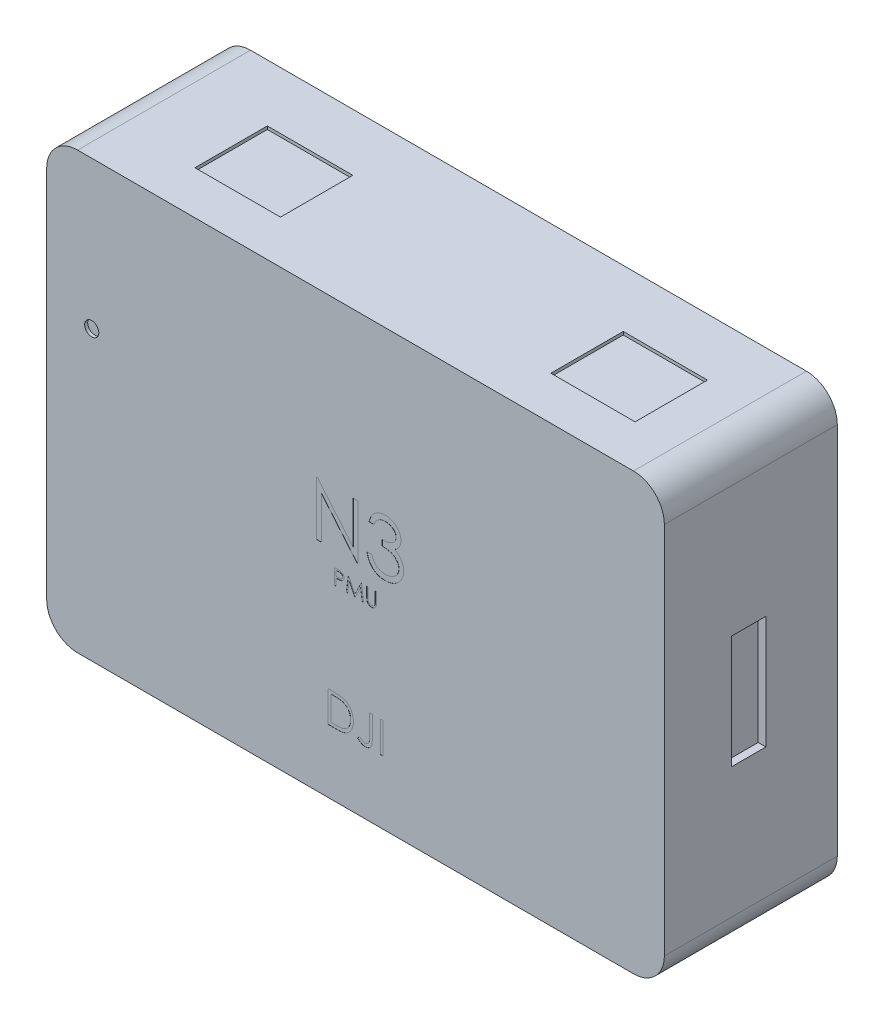
from build123d import *

# Parameters (mm, degrees)
SKETCH_1_W          = 40
SKETCH_1_H          = 28.2
EXTRUDE_1_DEPTH     = 11.2
WRAP_START          = -0.01
WRAP_1_OUTLINE_W    = 0.179487179
WRAP_1_OUTLINE_H    = 2
WRAP_1_DEPTH        = 0.01
FILLET_1_R          = 2
SKETCH_4_W          = 5.453779848
SKETCH_4_H          = 4.686842057
SKETCH_4_W_2        = 5.538995158
CUT_EXTRUDE_1_DEPTH = 0.2
SKETCH_6_W          = 2.403071746
SKETCH_6_H          = 11.775051554
CUT_EXTRUDE_2_DEPTH = 0.5
SKETCH_5_W          = 2.222841365
SKETCH_5_H          = 7.329368824
CUT_EXTRUDE_3_DEPTH = 0.5
SKETCH_7_R          = 0.458898489
CUT_EXTRUDE_4_DEPTH = 0.2


# Read off the part's stored shape, not the designer's step: 包覆1
with BuildPart() as part:
    # 草图1 → 凸台-拉伸1 (new body)
    with BuildSketch(Plane.XY):
        Rectangle(SKETCH_1_W, SKETCH_1_H)
    extrude(amount=EXTRUDE_1_DEPTH)

    # 包覆1 outline → 包覆1 (cut)
    # profile 1 of 8: a face of its own
    with BuildSketch(Plane.XY.offset(11.2).offset(WRAP_START)):
        with BuildLine():
            add(Edge.make_bspline(
                [(0.814102564, -1.599158654), (0.814089209, -1.607638864), (0.814063864, -1.623731524), (0.814233154, -1.646636753), (0.814707259, -1.667000313), (0.815006162, -1.684900698), (0.815671115, -1.700255769), (0.816213414, -1.713148714), (0.816910716, -1.723518487), (0.817748749, -1.72957018), (0.818108974, -1.732171474)],
                knots=[0, 0, 0, 0, 0.191078592, 0.362604556, 0.51609875, 0.650038026, 0.765976721, 0.862374026, 0.940842058, 1, 1, 1, 1], degree=3))
            Line((0.814102564, -1.599158654), (0.814102564, -1))
            Line((0.814102564, -1), (0.724358974, -1))
            Line((0.724358974, -1), (0.724358974, -1.603966346))
            add(Edge.make_bspline(
                [(0.7421875, -1.814703526), (0.740708312, -1.809379933), (0.73749992, -1.797832942), (0.734064121, -1.778722517), (0.731175812, -1.756718254), (0.728459938, -1.731818649), (0.726857379, -1.704004401), (0.725452396, -1.673287568), (0.724349076, -1.639631008), (0.724355583, -1.616186861), (0.724358974, -1.603966346)],
                knots=[0, 0, 0, 0, 0.078129865, 0.169465417, 0.274335291, 0.392110163, 0.52368733, 0.668365421, 0.827131902, 1, 1, 1, 1], degree=3))
            add(Edge.make_bspline(
                [(1.0546875, -2.025641026), (1.045067756, -2.025416807), (1.026193854, -2.024976891), (0.998382977, -2.022456105), (0.971721779, -2.017707992), (0.945928671, -2.011662294), (0.921354815, -2.003324084), (0.897670973, -1.993581762), (0.875282779, -1.981616831), (0.853827028, -1.968304433), (0.833877097, -1.953325965), (0.815563554, -1.937000201), (0.798856162, -1.919588664), (0.784036534, -1.900902845), (0.770859139, -1.881088072), (0.759507649, -1.860088289), (0.749761008, -1.837911627), (0.74473056, -1.822496427), (0.7421875, -1.814703526)],
                knots=[0, 0, 0, 0, 0.071174504, 0.139644122, 0.206317224, 0.27137324, 0.335418084, 0.398076345, 0.460607915, 0.522969511, 0.584715724, 0.64489494, 0.704290561, 0.76299819, 0.821087431, 0.880103891, 0.939388488, 1, 1, 1, 1], degree=3))
            add(Edge.make_bspline(
                [(1.365384615, -1.603966346), (1.36531201, -1.614851597), (1.365170315, -1.636094827), (1.363941579, -1.667223786), (1.361982436, -1.69675321), (1.359214411, -1.724687066), (1.355546696, -1.750925397), (1.351468061, -1.775698188), (1.346273909, -1.798827614), (1.340207223, -1.820494019), (1.333271923, -1.841118452), (1.324288738, -1.860692342), (1.314167452, -1.879810742), (1.302163266, -1.898184487), (1.288674299, -1.915894931), (1.273402391, -1.932834666), (1.25685263, -1.949274394), (1.238749899, -1.964792413), (1.219392606, -1.979023463), (1.198838333, -1.991537112), (1.17724497, -2.002115289), (1.154668648, -2.010822696), (1.131099733, -2.017369724), (1.10653763, -2.02224834), (1.080926432, -2.025020425), (1.063507959, -2.025432405), (1.0546875, -2.025641026)],
                knots=[0, 0, 0, 0, 0.054858035, 0.107058792, 0.156978355, 0.203992277, 0.248491536, 0.290483314, 0.330489004, 0.367885926, 0.403858131, 0.440009343, 0.476295011, 0.512792295, 0.550484825, 0.588381116, 0.627645327, 0.667979464, 0.708432758, 0.748602302, 0.789087777, 0.829461205, 0.870371045, 0.912214227, 0.955546575, 1, 1, 1, 1], degree=3))
            Line((1.365384615, -1.603966346), (1.365384615, -1))
            Line((1.365384615, -1), (1.275641026, -1))
            Line((1.275641026, -1), (1.275641026, -1.599158654))
            add(Edge.make_bspline(
                [(1.265424679, -1.754407051), (1.266281858, -1.750878887), (1.268191998, -1.743016716), (1.269976868, -1.729724918), (1.271835875, -1.714042243), (1.273125752, -1.695856011), (1.274383244, -1.675227161), (1.27513555, -1.652048231), (1.275483274, -1.626403385), (1.275586897, -1.608507053), (1.275641026, -1.599158654)],
                knots=[0, 0, 0, 0, 0.069835104, 0.155620755, 0.257801557, 0.373811234, 0.506402493, 0.655564458, 0.820079282, 1, 1, 1, 1], degree=3))
            add(Edge.make_bspline(
                [(1.049679487, -1.923076923), (1.057837699, -1.922770109), (1.074107002, -1.922158252), (1.098280268, -1.918369272), (1.121823156, -1.911540539), (1.144851922, -1.902729179), (1.166437917, -1.89108701), (1.186593187, -1.877638199), (1.204582882, -1.861863663), (1.220999453, -1.844406422), (1.235295149, -1.824709336), (1.247686904, -1.803201297), (1.257837169, -1.779558626), (1.262849605, -1.762943077), (1.265424679, -1.754407051)],
                knots=[0, 0, 0, 0, 0.082890648, 0.165302541, 0.247761876, 0.331527711, 0.415279813, 0.49636623, 0.577151348, 0.65778254, 0.739321642, 0.823793082, 0.909475953, 1, 1, 1, 1], degree=3))
            add(Edge.make_bspline(
                [(0.818108974, -1.732171474), (0.819588248, -1.741556264), (0.822463444, -1.759797044), (0.829790981, -1.785770838), (0.840024553, -1.809179827), (0.852151136, -1.830754481), (0.868131882, -1.849894298), (0.88727575, -1.867526199), (0.910469398, -1.882946715), (0.936258142, -1.897046947), (0.964053924, -1.908379827), (0.992457143, -1.91694936), (1.021040852, -1.922171903), (1.040176899, -1.922776628), (1.049679487, -1.923076923)],
                knots=[0, 0, 0, 0, 0.086315004, 0.167766466, 0.244432684, 0.318134662, 0.391884107, 0.47006805, 0.553904179, 0.644339498, 0.736874663, 0.826168364, 0.913678595, 1, 1, 1, 1], degree=3))
        make_face()
    # profile 2 of 8: a face of its own
    with BuildSketch(Plane.XY.offset(11.2).offset(WRAP_START)):
        with BuildLine():
            add(Edge.make_bspline(
                [(-1.169270833, -1), (-1.155782003, -1.000014827), (-1.129936805, -1.000043238), (-1.092875361, -1.000904594), (-1.059215437, -1.002055077), (-1.029029614, -1.003649904), (-1.002225015, -1.005534644), (-0.978922929, -1.008178084), (-0.958940199, -1.010938168), (-0.946966927, -1.013744284), (-0.94150641, -1.015024038)],
                knots=[0, 0, 0, 0, 0.176955752, 0.33905508, 0.486318225, 0.618780923, 0.735618828, 0.838742477, 0.926457068, 1, 1, 1, 1], degree=3))
            Line((-1.169270833, -1), (-1.365384615, -1))
            Line((-1.365384615, -1), (-1.365384615, -2))
            Line((-1.365384615, -2), (-1.275641026, -2))
            Line((-1.275641026, -2), (-1.275641026, -1.538461538))
            Line((-1.275641026, -1.538461538), (-1.204126603, -1.538461538))
            add(Edge.make_bspline(
                [(-0.949519231, -1.522035256), (-0.955784183, -1.523367537), (-0.969514191, -1.526287306), (-0.992126397, -1.529546866), (-1.018453651, -1.532329037), (-1.048460016, -1.534415077), (-1.082118561, -1.536200896), (-1.119447491, -1.537620351), (-1.160520085, -1.53840031), (-1.189169012, -1.538440536), (-1.204126603, -1.538461538)],
                knots=[0, 0, 0, 0, 0.075173117, 0.164746258, 0.268016881, 0.385911876, 0.517789479, 0.663690977, 0.824413221, 1, 1, 1, 1], degree=3))
            add(Edge.make_bspline(
                [(-0.75, -1.268229167), (-0.750120407, -1.276451389), (-0.750355992, -1.292538721), (-0.753183502, -1.316073804), (-0.756992128, -1.338564772), (-0.762848429, -1.359961758), (-0.770518621, -1.380137692), (-0.77951635, -1.399400902), (-0.790368788, -1.417423665), (-0.802838739, -1.434271413), (-0.816710623, -1.449959959), (-0.831925748, -1.464375615), (-0.848422689, -1.477433997), (-0.866149017, -1.489164381), (-0.885277545, -1.499294747), (-0.90551816, -1.508368262), (-0.927046794, -1.515988565), (-0.941944655, -1.519997154), (-0.949519231, -1.522035256)],
                knots=[0, 0, 0, 0, 0.070118894, 0.137192353, 0.202016181, 0.264631407, 0.326116547, 0.386010305, 0.445811847, 0.505297697, 0.564633278, 0.624282625, 0.683902032, 0.743952771, 0.805387731, 0.868388031, 0.933084028, 1, 1, 1, 1], degree=3))
            add(Edge.make_bspline(
                [(-0.94150641, -1.015024038), (-0.934593972, -1.016916024), (-0.920931979, -1.020655413), (-0.901245966, -1.028145048), (-0.882516296, -1.037025667), (-0.864678708, -1.047146793), (-0.847952399, -1.058942668), (-0.832087815, -1.07193513), (-0.817224964, -1.08642415), (-0.803447423, -1.102247219), (-0.790794624, -1.119138707), (-0.779900429, -1.137350773), (-0.770778364, -1.156576859), (-0.762954572, -1.176803594), (-0.757323585, -1.198200829), (-0.753081614, -1.22061989), (-0.750389149, -1.244058373), (-0.750131274, -1.260075478), (-0.75, -1.268229167)],
                knots=[0, 0, 0, 0, 0.062481339, 0.123490383, 0.183411094, 0.243153221, 0.302126735, 0.361709671, 0.421842292, 0.482931901, 0.544552254, 0.60568072, 0.667679738, 0.729984388, 0.794550921, 0.86034562, 0.928907356, 1, 1, 1, 1], degree=3))
        make_face()
        with BuildLine():
            add(Edge.make_bspline(
                [(-1.100560897, -1.438100962), (-1.092012347, -1.43810538), (-1.075509547, -1.438113909), (-1.051670626, -1.436975274), (-1.029553687, -1.435660836), (-1.009226666, -1.433736286), (-0.990680399, -1.431015927), (-0.973883962, -1.428269716), (-0.958967595, -1.424296755), (-0.94151068, -1.418947307), (-0.922058295, -1.409823702), (-0.900896139, -1.396580877), (-0.882961685, -1.379700674), (-0.867442172, -1.360721294), (-0.855126207, -1.339607257), (-0.846110209, -1.317016132), (-0.840812736, -1.293179604), (-0.840102395, -1.276868707), (-0.83974359, -1.268629808)],
                knots=[0, 0, 0, 0, 0.072538371, 0.140033831, 0.202495681, 0.260575056, 0.313228338, 0.361583194, 0.404878361, 0.444127437, 0.516399693, 0.586506671, 0.655085374, 0.724383783, 0.793973529, 0.861637682, 0.930110942, 1, 1, 1, 1], degree=3))
            Line((-1.100560897, -1.438100962), (-1.275641026, -1.435897436))
            Line((-1.275641026, -1.435897436), (-1.275641026, -1.102564103))
            Line((-1.275641026, -1.102564103), (-1.092748397, -1.102564103))
            add(Edge.make_bspline(
                [(-0.83974359, -1.268629808), (-0.840104346, -1.260590232), (-0.840821484, -1.244608552), (-0.846151731, -1.221186049), (-0.855108678, -1.19883299), (-0.867524848, -1.177983537), (-0.882593742, -1.159072451), (-0.90010784, -1.1426447), (-0.920025915, -1.129438499), (-0.938553981, -1.120914704), (-0.955011462, -1.11571034), (-0.969306308, -1.112068957), (-0.985446501, -1.109161641), (-1.003437295, -1.106807497), (-1.023139248, -1.104792223), (-1.044721623, -1.103424801), (-1.068102664, -1.102624385), (-1.084334256, -1.102584683), (-1.092748397, -1.102564103)],
                knots=[0, 0, 0, 0, 0.070043755, 0.139238317, 0.208197455, 0.279173374, 0.349986812, 0.418353846, 0.487609584, 0.557411073, 0.595330157, 0.637964052, 0.685912778, 0.738185165, 0.796102647, 0.858516544, 0.926657726, 1, 1, 1, 1], degree=3))
        make_face(mode=Mode.SUBTRACT)
    # profile 3 of 8: a face of its own
    with BuildSketch(Plane.XY.offset(11.2).offset(WRAP_START)):
        with BuildLine():
            add(Edge.make_bspline(
                [(0.876438504, 2.692307692), (0.884948055, 2.727540176), (0.901583531, 2.796416801), (0.936281104, 2.894824062), (0.974080359, 2.987947583), (1.019469464, 3.074043657), (1.068978218, 3.154842559), (1.12570094, 3.228511684), (1.187020662, 3.296924649), (1.254845612, 3.357637887), (1.325974273, 3.412615616), (1.401408893, 3.459490673), (1.479631787, 3.499814826), (1.56118492, 3.533035058), (1.646311091, 3.558060582), (1.734240715, 3.576217387), (1.825204215, 3.588008502), (1.886951805, 3.589159265), (1.918305492, 3.58974359)],
                knots=[0, 0, 0, 0, 0.072625346, 0.141976611, 0.208984928, 0.27395687, 0.336889347, 0.398744953, 0.460115885, 0.520824923, 0.580994459, 0.640151928, 0.698622451, 0.757271081, 0.816426694, 0.876254048, 0.937165293, 1, 1, 1, 1], degree=3))
            Line((0.876438504, 2.692307692), (1.190541069, 2.692307692))
            add(Edge.make_bspline(
                [(1.922512222, 3.230769231), (1.882660554, 3.229377869), (1.804820978, 3.226660215), (1.692606061, 3.202857202), (1.588286727, 3.164879118), (1.508548061, 3.119546099), (1.449665486, 3.074795665), (1.407588548, 3.035713279), (1.366268038, 2.992280455), (1.328422361, 2.94182208), (1.290148384, 2.887755289), (1.255303823, 2.827331608), (1.22144413, 2.762127214), (1.201041581, 2.716031579), (1.190541069, 2.692307692)],
                knots=[0, 0, 0, 0, 0.122711942, 0.239684964, 0.351815855, 0.463766133, 0.520817793, 0.579448291, 0.640604145, 0.705297512, 0.773633881, 0.844669382, 0.920056508, 1, 1, 1, 1], degree=3))
            add(Edge.make_bspline(
                [(2.626438504, 2.681790865), (2.626024094, 2.700068611), (2.625199643, 2.736431318), (2.614802365, 2.789556386), (2.599178324, 2.841057332), (2.577698594, 2.890715142), (2.548948396, 2.938185416), (2.514542409, 2.983872865), (2.473574309, 3.027516644), (2.426628862, 3.068196964), (2.376217057, 3.106966201), (2.320967282, 3.139879838), (2.262545407, 3.1680249), (2.200886752, 3.191234402), (2.135791222, 3.20869369), (2.067564664, 3.221229532), (1.996076981, 3.229067187), (1.947305249, 3.230195602), (1.922512222, 3.230769231)],
                knots=[0, 0, 0, 0, 0.055274549, 0.109966094, 0.163247443, 0.218076185, 0.273300874, 0.3309093, 0.390994523, 0.454175953, 0.518861541, 0.583310532, 0.648516682, 0.715030887, 0.782502073, 0.852322685, 0.92492849, 1, 1, 1, 1], degree=3))
            add(Edge.make_bspline(
                [(1.729002607, 2.108974359), (1.772303773, 2.109709163), (1.857120119, 2.111148463), (1.981014424, 2.128556473), (2.099487736, 2.152637101), (2.209914478, 2.189522293), (2.310563192, 2.23236259), (2.397882794, 2.2822148), (2.470649941, 2.337629549), (2.528511012, 2.399462158), (2.572040241, 2.465777206), (2.603867038, 2.534893864), (2.622667365, 2.607417924), (2.625177032, 2.656912592), (2.626438504, 2.681790865)],
                knots=[0, 0, 0, 0, 0.110165553, 0.215787256, 0.318027435, 0.417573954, 0.511650488, 0.596162097, 0.672934533, 0.743669557, 0.810677001, 0.874058962, 0.936696302, 1, 1, 1, 1], degree=3))
            Line((1.729002607, 2.108974359), (1.729002607, 1.75))
            add(Edge.make_bspline(
                [(2.805925684, 1.009615385), (2.804395382, 1.042226723), (2.801342394, 1.107287132), (2.778033815, 1.203004706), (2.73969495, 1.295228118), (2.686022439, 1.382383909), (2.62068671, 1.46315981), (2.544321803, 1.535231293), (2.456293575, 1.594701384), (2.375273706, 1.63579004), (2.30350855, 1.663827115), (2.242093165, 1.68250208), (2.173336562, 1.698315735), (2.098070213, 1.713028007), (2.015726996, 1.725549355), (1.926396558, 1.735991171), (1.830060797, 1.744346212), (1.763369631, 1.748077307), (1.729002607, 1.75)],
                knots=[0, 0, 0, 0, 0.066909186, 0.13348544, 0.201035117, 0.27123434, 0.342879984, 0.41383613, 0.485976622, 0.560229557, 0.599884181, 0.64405484, 0.691891932, 0.744687524, 0.801491775, 0.862857698, 0.929328379, 1, 1, 1, 1], degree=3))
            add(Edge.make_bspline(
                [(1.914799883, 0.269230769), (1.947553385, 0.269846674), (2.011600032, 0.271051024), (2.105054892, 0.282126731), (2.193962339, 0.298257144), (2.277335265, 0.323170127), (2.356265772, 0.353950979), (2.429647422, 0.392599384), (2.498443528, 0.437944106), (2.561772933, 0.489483264), (2.618718441, 0.545904759), (2.668857954, 0.60491783), (2.711482616, 0.66627366), (2.745866194, 0.730311781), (2.773016744, 0.79676701), (2.791499945, 0.865825839), (2.80435146, 0.936923105), (2.805398072, 0.985252074), (2.805925684, 1.009615385)],
                knots=[0, 0, 0, 0, 0.076071737, 0.148751715, 0.218402794, 0.285759581, 0.350598024, 0.414964045, 0.478069339, 0.541760676, 0.604349859, 0.664075021, 0.721463623, 0.777587128, 0.832644447, 0.887843511, 0.943460343, 1, 1, 1, 1], degree=3))
            add(Edge.make_bspline(
                [(1.330064306, 0.458533654), (1.349660882, 0.44342532), (1.388793545, 0.413255288), (1.452561776, 0.37475366), (1.519626662, 0.341392634), (1.591441337, 0.315908939), (1.666456107, 0.294331278), (1.745883472, 0.280210759), (1.829022689, 0.270522587), (1.885790453, 0.269667656), (1.914799883, 0.269230769)],
                knots=[0, 0, 0, 0, 0.118271305, 0.236177533, 0.355662933, 0.475904165, 0.600127342, 0.728608116, 0.861313476, 1, 1, 1, 1], degree=3))
            add(Edge.make_bspline(
                [(1.055925684, 0.942307692), (1.064108975, 0.915358679), (1.080026188, 0.862940507), (1.107120486, 0.787500202), (1.137988758, 0.718342149), (1.171103317, 0.654959027), (1.205881763, 0.596726624), (1.244796688, 0.545184755), (1.284965833, 0.498069553), (1.315245186, 0.471524941), (1.330064306, 0.458533654)],
                knots=[0, 0, 0, 0, 0.149770386, 0.29131641, 0.425966373, 0.552159574, 0.671527414, 0.786121629, 0.895325073, 1, 1, 1, 1], degree=3))
            Line((1.055925684, 0.942307692), (0.74182312, 0.942307692))
            add(Edge.make_bspline(
                [(1.909190908, -0.08974359), (1.871771608, -0.088875376), (1.798142903, -0.087167022), (1.689899405, -0.075488421), (1.586577705, -0.054158416), (1.488038107, -0.025455111), (1.394193071, 0.010936632), (1.305328966, 0.05625533), (1.220899072, 0.109566832), (1.141700121, 0.171500419), (1.067741553, 0.240781759), (1.000988829, 0.318640769), (0.940329036, 0.403638173), (0.887386398, 0.496761229), (0.839749445, 0.596806487), (0.800568488, 0.705054985), (0.76608292, 0.820539007), (0.750049455, 0.901016747), (0.74182312, 0.942307692)],
                knots=[0, 0, 0, 0, 0.06554117, 0.128963168, 0.190377136, 0.250092362, 0.308548432, 0.366397963, 0.424542189, 0.483169996, 0.5422434, 0.601739352, 0.662506002, 0.724855513, 0.789127829, 0.8563464, 0.926295235, 1, 1, 1, 1], degree=3))
            add(Edge.make_bspline(
                [(3.120028248, 1.039763622), (3.118233735, 0.990753901), (3.114653153, 0.892965099), (3.082649078, 0.748490377), (3.033035838, 0.607264875), (2.962578902, 0.472190036), (2.876711393, 0.345809655), (2.774554069, 0.232733346), (2.65726766, 0.135534741), (2.526462011, 0.054324513), (2.384744883, -0.010593409), (2.233169291, -0.055650852), (2.073919237, -0.084996852), (1.964711939, -0.08814372), (1.909190908, -0.08974359)],
                knots=[0, 0, 0, 0, 0.079648251, 0.158921676, 0.239619495, 0.32260943, 0.406034637, 0.487602095, 0.569684627, 0.653036145, 0.737435718, 0.822477816, 0.909747655, 1, 1, 1, 1], degree=3))
            add(Edge.make_bspline(
                [(2.911093953, 1.661658654), (2.927935296, 1.638600902), (2.961342192, 1.592862986), (3.002577725, 1.51932656), (3.03998684, 1.444975071), (3.069137059, 1.367815664), (3.091710926, 1.288742651), (3.107846958, 1.207620255), (3.117871099, 1.124382232), (3.119306651, 1.068069752), (3.120028248, 1.039763622)],
                knots=[0, 0, 0, 0, 0.12813551, 0.254172712, 0.378111645, 0.501712263, 0.623986309, 0.747095614, 0.872874637, 1, 1, 1, 1], degree=3))
            add(Edge.make_bspline(
                [(2.531787062, 1.960336538), (2.569018817, 1.942358367), (2.642785691, 1.906738409), (2.743336221, 1.836882652), (2.834614096, 1.756226304), (2.885517815, 1.693283652), (2.911093953, 1.661658654)],
                knots=[0, 0, 0, 0, 0.2538796, 0.503008917, 0.750291081, 1, 1, 1, 1], degree=3))
            add(Edge.make_bspline(
                [(2.940541069, 2.680388622), (2.939377478, 2.643381827), (2.93710051, 2.570965273), (2.917766805, 2.465243775), (2.885230542, 2.365602175), (2.840160779, 2.271621013), (2.781819229, 2.183896173), (2.711146532, 2.102230282), (2.62764387, 2.026261124), (2.564364932, 1.982741651), (2.531787062, 1.960336538)],
                knots=[0, 0, 0, 0, 0.128067549, 0.250608319, 0.370630166, 0.490072247, 0.610374764, 0.73431307, 0.863216504, 1, 1, 1, 1], degree=3))
            add(Edge.make_bspline(
                [(1.918305492, 3.58974359), (1.963988234, 3.588364359), (2.054357245, 3.585635984), (2.187120292, 3.560721548), (2.315147111, 3.521296415), (2.437036359, 3.466822688), (2.550254791, 3.399635375), (2.650990978, 3.319670638), (2.737879489, 3.228471337), (2.810773866, 3.127738772), (2.867848865, 3.020083263), (2.909935239, 2.909283106), (2.93555692, 2.795601134), (2.938877477, 2.718843855), (2.940541069, 2.680388622)],
                knots=[0, 0, 0, 0, 0.090254249, 0.178539792, 0.266093034, 0.354630978, 0.441886153, 0.525746915, 0.608113634, 0.690197273, 0.770821484, 0.848326181, 0.92401174, 1, 1, 1, 1], degree=3))
        make_face()
    # profile 4 of 8: a face of its own
    with BuildSketch(Plane.XY.offset(11.2).offset(WRAP_START)):
        with BuildLine():
            add(Edge.make_bspline(
                [(-1.378205128, -8), (-1.343079992, -8.000252897), (-1.275218412, -8.000741493), (-1.177154156, -8.003839431), (-1.086420578, -8.009319697), (-1.003316087, -8.017302283), (-0.927612537, -8.027104017), (-0.859521904, -8.039389962), (-0.798692108, -8.053897488), (-0.761280999, -8.066266317), (-0.743589744, -8.072115385)],
                knots=[0, 0, 0, 0, 0.164289216, 0.317405911, 0.458843612, 0.589366542, 0.707831319, 0.815770031, 0.912879903, 1, 1, 1, 1], degree=3))
            Line((-1.378205128, -8), (-1.782051282, -8))
            Line((-1.782051282, -8), (-1.782051282, -10))
            Line((-1.782051282, -10), (-1.162259615, -10))
            add(Edge.make_bspline(
                [(-0.141025641, -9.025240385), (-0.141385051, -9.049961092), (-0.142093306, -9.098675829), (-0.148452915, -9.170470626), (-0.157696526, -9.240135524), (-0.172007497, -9.307338781), (-0.189380361, -9.372669192), (-0.211645591, -9.435430474), (-0.237151589, -9.496198365), (-0.266894376, -9.554151209), (-0.299546596, -9.609055993), (-0.334587592, -9.660813437), (-0.37197999, -9.708684993), (-0.412080351, -9.752815628), (-0.454370475, -9.793138816), (-0.499127236, -9.829991396), (-0.546466122, -9.862652284), (-0.596175106, -9.892404918), (-0.649704323, -9.918359407), (-0.708067675, -9.940319412), (-0.771514062, -9.958517478), (-0.839887752, -9.973700847), (-0.913306882, -9.98574502), (-0.991843434, -9.993817244), (-1.075376742, -9.999276063), (-1.132736323, -9.999754002), (-1.162259615, -10)],
                knots=[0, 0, 0, 0, 0.046080683, 0.0908068, 0.134295271, 0.177024386, 0.218822734, 0.260244116, 0.301079867, 0.341613894, 0.381583419, 0.420119591, 0.458074619, 0.494738488, 0.531194623, 0.566933698, 0.602712651, 0.638326606, 0.674853249, 0.713467371, 0.754441804, 0.797815361, 0.843989456, 0.89307157, 0.944963346, 1, 1, 1, 1], degree=3))
            add(Edge.make_bspline(
                [(-0.743589744, -8.072115385), (-0.720449893, -8.080932931), (-0.674694926, -8.09836807), (-0.609547998, -8.131257385), (-0.54821922, -8.168522015), (-0.490379708, -8.210211079), (-0.437350665, -8.257504993), (-0.387060438, -8.308394756), (-0.34156631, -8.36473095), (-0.299904426, -8.425345229), (-0.262341192, -8.489523545), (-0.229690245, -8.557143607), (-0.202573678, -8.627862011), (-0.180063262, -8.701482096), (-0.162322429, -8.77816574), (-0.150218468, -8.858002235), (-0.142235046, -8.940676058), (-0.141432731, -8.996775751), (-0.141025641, -9.025240385)],
                knots=[0, 0, 0, 0, 0.061544966, 0.121694296, 0.181154855, 0.239875389, 0.298701942, 0.357647424, 0.417604843, 0.478494041, 0.540407051, 0.602344994, 0.665004328, 0.728559309, 0.793650542, 0.860534268, 0.929235961, 1, 1, 1, 1], degree=3))
        make_face()
        with BuildLine():
            add(Edge.make_bspline(
                [(-1.372996795, -9.794871795), (-1.340009154, -9.794730026), (-1.276561841, -9.794457351), (-1.1853287, -9.792064664), (-1.101969045, -9.788154985), (-1.026471039, -9.782683512), (-0.958877311, -9.775444303), (-0.899046597, -9.76737293), (-0.847175021, -9.757317244), (-0.815786771, -9.74820241), (-0.801282051, -9.743990385)],
                knots=[0, 0, 0, 0, 0.171900665, 0.330627932, 0.475548836, 0.60674619, 0.725023803, 0.829742387, 0.92132282, 1, 1, 1, 1], degree=3))
            Line((-1.372996795, -9.794871795), (-1.602564103, -9.794871795))
            Line((-1.602564103, -9.794871795), (-1.602564103, -8.205128205))
            Line((-1.602564103, -8.205128205), (-1.461939103, -8.205128205))
            add(Edge.make_bspline(
                [(-0.847355769, -8.261217949), (-0.864127853, -8.25657999), (-0.899789904, -8.246718417), (-0.957983884, -8.235961061), (-1.023478255, -8.226472776), (-1.096563799, -8.218439611), (-1.177157204, -8.212675427), (-1.265320454, -8.208348962), (-1.361091657, -8.205430886), (-1.427481676, -8.205231625), (-1.461939103, -8.205128205)],
                knots=[0, 0, 0, 0, 0.084318617, 0.179284514, 0.286582528, 0.405111483, 0.535592873, 0.67819021, 0.83297584, 1, 1, 1, 1], degree=3))
            add(Edge.make_bspline(
                [(-0.320512821, -9.024839744), (-0.320806128, -9.001449183), (-0.321382332, -8.955498221), (-0.328624795, -8.888074966), (-0.339208541, -8.82322888), (-0.354513504, -8.760955626), (-0.374016864, -8.70113371), (-0.398356659, -8.64409399), (-0.426166156, -8.589234065), (-0.459253777, -8.537820142), (-0.495491259, -8.489195508), (-0.53570719, -8.444649842), (-0.57926264, -8.404081671), (-0.625682554, -8.366859206), (-0.676275183, -8.334479963), (-0.72984872, -8.305516145), (-0.787189104, -8.280935636), (-0.827082073, -8.267862), (-0.847355769, -8.261217949)],
                knots=[0, 0, 0, 0, 0.070151176, 0.137812606, 0.203226247, 0.267174055, 0.330024003, 0.391794272, 0.453084399, 0.514333908, 0.574999993, 0.634865483, 0.694116315, 0.753441622, 0.8131258, 0.874079686, 0.936007013, 1, 1, 1, 1], degree=3))
            add(Edge.make_bspline(
                [(-0.801282051, -9.743990385), (-0.783025844, -9.737560923), (-0.74694948, -9.724855567), (-0.695017431, -9.70167976), (-0.646584857, -9.674227149), (-0.6008077, -9.643711564), (-0.558335325, -9.609056706), (-0.518664401, -9.57101614), (-0.481874801, -9.529396269), (-0.448346625, -9.484248748), (-0.41834188, -9.435854579), (-0.39235832, -9.384689531), (-0.369586016, -9.331314211), (-0.351712535, -9.274908978), (-0.337703629, -9.215978087), (-0.327780951, -9.154517394), (-0.321601108, -9.090538376), (-0.320880281, -9.047022876), (-0.320512821, -9.024839744)],
                knots=[0, 0, 0, 0, 0.0624145, 0.123338231, 0.183124538, 0.241782995, 0.300578883, 0.359680075, 0.418881641, 0.479530664, 0.540850536, 0.602303396, 0.664463212, 0.727805723, 0.792894815, 0.859672328, 0.928464401, 1, 1, 1, 1], degree=3))
        make_face(mode=Mode.SUBTRACT)
    # profile 5 of 8: a face of its own
    with BuildSketch(Plane.XY.offset(11.2).offset(WRAP_START)):
        with BuildLine():
            add(Edge.make_bspline(
                [(1.08974359, -9.350560897), (1.089564208, -9.375535281), (1.089219772, -9.423489144), (1.087325823, -9.492559942), (1.083820979, -9.555628906), (1.078715257, -9.612839447), (1.071903696, -9.664012335), (1.064108823, -9.709542974), (1.054672938, -9.749051364), (1.040463528, -9.793414424), (1.017164129, -9.842068027), (0.98209725, -9.894613828), (0.938535652, -9.940575776), (0.888077919, -9.980491619), (0.830283048, -10.012295751), (0.766341208, -10.035127282), (0.696646016, -10.049053486), (0.648303609, -10.050524289), (0.623397436, -10.051282051)],
                knots=[0, 0, 0, 0, 0.077360684, 0.148541953, 0.214007737, 0.272994503, 0.326409196, 0.373880401, 0.416019938, 0.45212552, 0.518001711, 0.58236693, 0.647043782, 0.713330421, 0.78091197, 0.850394959, 0.922922974, 1, 1, 1, 1], degree=3))
            Line((1.08974359, -9.350560897), (1.08974359, -8))
            Line((1.08974359, -8), (0.91025641, -8))
            Line((0.91025641, -8), (0.91025641, -9.330528846))
            add(Edge.make_bspline(
                [(0.633413462, -9.846153846), (0.647232198, -9.845569426), (0.674546744, -9.844414243), (0.714240455, -9.834214658), (0.752216473, -9.818646427), (0.78711342, -9.795851402), (0.819276499, -9.768747733), (0.845815256, -9.735972871), (0.867939396, -9.699649452), (0.881253506, -9.665265764), (0.889736233, -9.633907689), (0.89512002, -9.605088755), (0.899827826, -9.571396481), (0.90393157, -9.532790652), (0.906334124, -9.489193977), (0.909029709, -9.440734467), (0.910004144, -9.387289945), (0.910169755, -9.350026544), (0.91025641, -9.330528846)],
                knots=[0, 0, 0, 0, 0.062326366, 0.123196245, 0.18403622, 0.246964085, 0.310699396, 0.373267637, 0.43658758, 0.502124791, 0.539004722, 0.583255376, 0.634446515, 0.692676046, 0.758570486, 0.831658675, 0.911917102, 1, 1, 1, 1], degree=3))
            add(Edge.make_bspline(
                [(0.502403846, -9.817307692), (0.513423453, -9.821627382), (0.535035355, -9.830099256), (0.568078258, -9.839554055), (0.600932565, -9.844721146), (0.622714104, -9.845681908), (0.633413462, -9.846153846)],
                knots=[0, 0, 0, 0, 0.262951626, 0.515706692, 0.762109227, 1, 1, 1, 1], degree=3))
            add(Edge.make_bspline(
                [(0.246794872, -9.666666667), (0.271196403, -9.68349375), (0.317269675, -9.715265478), (0.384986498, -9.756137821), (0.444984871, -9.791180773), (0.48423227, -9.809039218), (0.502403846, -9.817307692)],
                knots=[0, 0, 0, 0, 0.299184288, 0.564898946, 0.798547869, 1, 1, 1, 1], degree=3))
            Line((0.246794872, -9.666666667), (0.141025641, -9.820512821))
            add(Edge.make_bspline(
                [(0.623397436, -10.051282051), (0.60399266, -10.05066456), (0.564948965, -10.049422128), (0.506839988, -10.039295435), (0.448896002, -10.023686267), (0.39080946, -10.000827641), (0.331432751, -9.969738728), (0.269961695, -9.929061689), (0.205605586, -9.878872246), (0.163215137, -9.840564963), (0.141025641, -9.820512821)],
                knots=[0, 0, 0, 0, 0.106070902, 0.21342168, 0.321685488, 0.433857939, 0.554081283, 0.687587044, 0.83646585, 1, 1, 1, 1], degree=3))
        make_face()
    # profile 6 of 8: a face of its own
    with BuildSketch(Plane.XY.offset(11.2).offset(WRAP_START)):
        Polygon((-2.467912457, 3.5), (-2.533817906, 3.5), (-2.533817906, 0), (-2.219715342, 0), (-2.219715342, 2.748397436), (0.086975363, 0), (0.158489787, 0), (0.158489787, 3.5), (-0.155612778, 3.5), (-0.155612778, 0.745292468), align=None)
    # profile 7 of 8: a face of its own
    with BuildSketch(Plane.XY.offset(11.2).offset(WRAP_START)):
        Polygon((-0.451322115, -1), (-0.464142628, -1), (-0.596153846, -2), (-0.505809295, -2), (-0.41025641, -1.278846154), (-0.047876603, -2), (-0.027644231, -2), (0.333333333, -1.280448718), (0.429086538, -2), (0.519230769, -2), (0.386418269, -1), (0.373397436, -1), (-0.038461538, -1.820512821), align=None)
    # profile 8 of 8: a face of its own
    with BuildSketch(Plane.XY.offset(11.2).offset(WRAP_START)):
        with Locations((1.692307693, -9)):
            Rectangle(WRAP_1_OUTLINE_W, WRAP_1_OUTLINE_H)
    extrude(amount=WRAP_1_DEPTH, mode=Mode.SUBTRACT)

    # 圆角1
    fillet_1_edges = [part.edges().sort_by_distance(p)[0] for p in [
        (20, -14.1, 5.6),
        (-20, -14.1, 5.6),
        (-20, 14.1, 5.6),
        (20, 14.1, 5.6),
    ]]
    fillet(fillet_1_edges, radius=FILLET_1_R)

    # 草图4 → 切除-拉伸1 (cut)
    with BuildSketch(Plane(origin=(0, 14.1, 0), x_dir=(1, 0, 0), z_dir=(0, 1, 0))):
        with Locations((12.569258244, -6.047380378)):
            Rectangle(SKETCH_4_W, SKETCH_4_H)
        with Locations((-10.438875491, -6.047380378)):
            Rectangle(SKETCH_4_W_2, SKETCH_4_H)
    extrude(amount=-CUT_EXTRUDE_1_DEPTH, mode=Mode.SUBTRACT)

    # 草图6 → 切除-拉伸2 (cut)
    with BuildSketch(Plane.ZY.offset(20)):
        with Locations((5.97547996, 0)):
            Rectangle(SKETCH_6_W, SKETCH_6_H)
    extrude(amount=-CUT_EXTRUDE_2_DEPTH, mode=Mode.SUBTRACT)

    # 草图5 → 切除-拉伸3 (cut)
    with BuildSketch(Plane(origin=(20, 0, 0), x_dir=(0, 0, -1), z_dir=(1, 0, 0))):
        with Locations((-5.735172785, 0)):
            Rectangle(SKETCH_5_W, SKETCH_5_H)
    extrude(amount=-CUT_EXTRUDE_3_DEPTH, mode=Mode.SUBTRACT)

    # 草图7 → 切除-拉伸4 (cut)
    with BuildSketch(Plane.XY.offset(11.2)):
        with Locations((-17.085669681, 4.537715264)):
            Circle(SKETCH_7_R)
    extrude(amount=-CUT_EXTRUDE_4_DEPTH, mode=Mode.SUBTRACT)


solid = part.part
